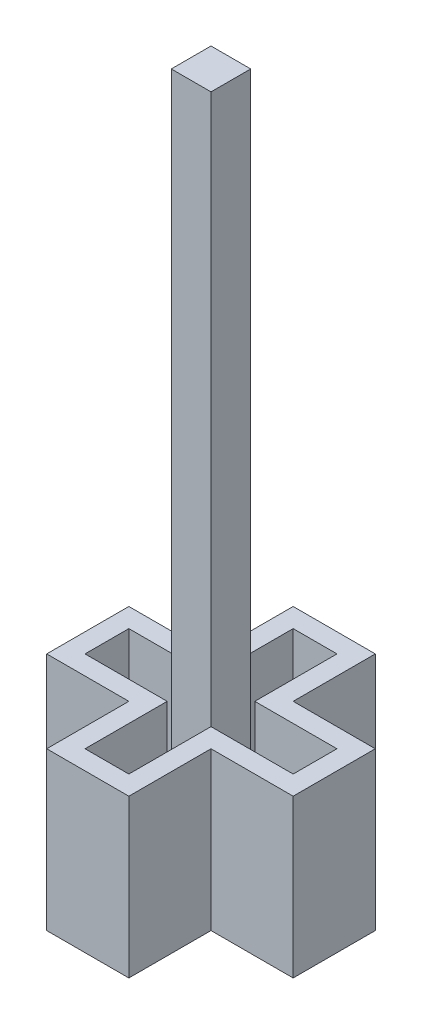
from build123d import *

# Parameters (mm, degrees)
BOSS_EXTRUDE1_DEPTH = 1.5
BOSS_EXTRUDE5_DEPTH = 10
SKETCH2_W           = 2.9
SKETCH2_H           = 2.9
BOSS_EXTRUDE2_DEPTH = 10
SKETCH10_W          = 2.9
SKETCH10_H          = 2.9
BOSS_EXTRUDE9_DEPTH = 40


with BuildPart() as part:
    # Sketch1 → Boss-Extrude1 (new body)
    with BuildSketch(Plane(origin=(0, 0, 0), x_dir=(1, 0, 0), z_dir=(0, 1, 0))):
        Polygon((-3, 3), (-3, 9), (3, 9), (3, 3), (9, 3), (9, -3), (3, -3), (3, -9), (-3, -9), (-3, -3), (-9, -3), (-9, 3), align=None)
    extrude(amount=BOSS_EXTRUDE1_DEPTH)

    # Sketch3 → Boss-Extrude5 (add)
    with BuildSketch(Plane(origin=(0, 1.5, 0), x_dir=(1, 0, 0), z_dir=(0, 1, 0))):
        Polygon((-3, 3), (-9, 3), (-9, -3), (-3, -3), (-3, -9), (3, -9), (3, -3), (9, -3), (9, 3), (3, 3), (3, 9), (-3, 9), align=None)
        Polygon((-1.6, 1.6), (-7.6, 1.6), (-7.6, -1.6), (-1.6, -1.6), (-1.6, -7.6), (1.6, -7.6), (1.6, -1.6), (7.6, -1.6), (7.6, 1.6), (1.6, 1.6), (1.6, 7.6), (-1.6, 7.6), align=None, mode=Mode.SUBTRACT)
    extrude(amount=BOSS_EXTRUDE5_DEPTH)

    # Sketch2 → Boss-Extrude2 (add)
    with BuildSketch(Plane(origin=(0, 1.5, 0), x_dir=(1, 0, 0), z_dir=(0, 1, 0))):
        Rectangle(SKETCH2_W, SKETCH2_H)
    extrude(amount=BOSS_EXTRUDE2_DEPTH)

    # Sketch10 → Boss-Extrude9 (add)
    with BuildSketch(Plane(origin=(0, 11.5, 0), x_dir=(1, 0, 0), z_dir=(0, 1, 0))):
        Rectangle(SKETCH10_W, SKETCH10_H)
    extrude(amount=BOSS_EXTRUDE9_DEPTH)


solid = part.part
